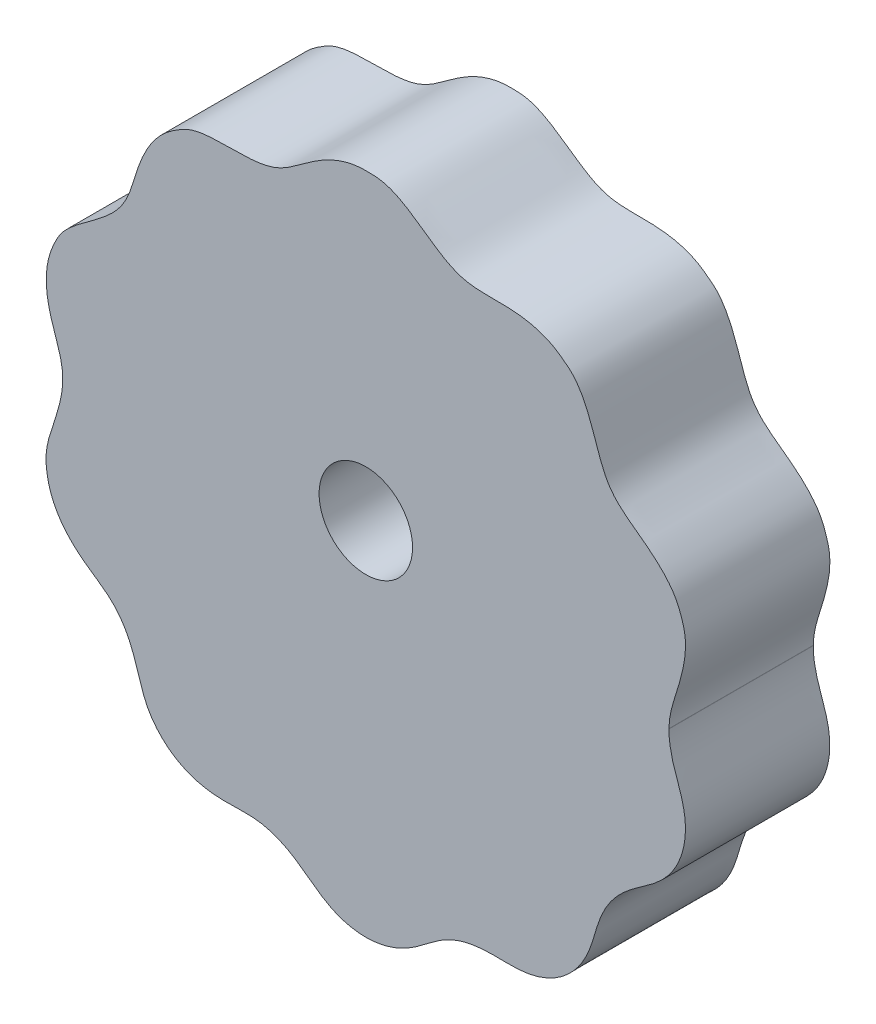
from build123d import *

# Parameters (mm, degrees)
BOSS_EXTRUDE1_DEPTH = 5
SKETCH2_R           = 1.618844033
CUT_EXTRUDE1_DEPTH  = 17.732655758


# Read off the part's stored shape, not the designer's step: Boss-Extrude1
with BuildPart() as part:
    # Boss-Extrude1 outline → Boss-Extrude1 (new body)
    with BuildSketch(Plane.XY):
        with BuildLine():
            ThreePointArc((10.5, 1e-09), (10.5000065, 0.005250059), (10.500026, 0.010500084))
            add(Edge.make_bspline(
                [(10.500026, 0.010500084), (10.500104829, 0.026418426), (10.500711566, 0.058279628), (10.503009847, 0.114829083), (10.508726656, 0.196966447), (10.518969394, 0.295241714), (10.535875913, 0.40525236), (10.561506893, 0.534666034), (10.597048035, 0.682169538), (10.637071722, 0.827718675), (10.680031003, 0.972663062), (10.727444508, 1.126258831), (10.778313871, 1.288813593), (10.84528106, 1.506056697), (10.924216926, 1.779180038), (11.003483342, 2.101494221), (11.059665237, 2.437947823), (11.08140617, 2.74012666), (11.071544465, 3.004316457), (11.042325947, 3.200172879), (10.998300633, 3.363746196), (10.954993199, 3.499695197), (10.919114129, 3.610142136), (10.87155734, 3.749924357), (10.802800407, 3.915605737), (10.702518555, 4.099545531), (10.546198292, 4.32750447), (10.343492757, 4.566838229), (10.092899585, 4.812528044), (9.79623736, 5.061693175), (9.446212806, 5.325219722), (9.051940581, 5.609976608), (8.681783648, 5.910451317), (8.401056293, 6.280926544), (8.225048404, 6.636685362), (8.102903432, 6.946209909), (7.992589426, 7.267087473), (7.881596028, 7.594881973), (7.762084294, 7.927074028), (7.623704413, 8.259245998), (7.475984099, 8.550085045), (7.316891743, 8.794957098), (7.150757, 8.992590127), (6.983282128, 9.141116165), (6.80096353, 9.273164945), (6.618334207, 9.407742368), (6.370182037, 9.551999196), (6.06478435, 9.677880619), (5.705292207, 9.774213768), (5.199387941, 9.849483561), (4.659334614, 9.871051553), (4.078900176, 9.853571976), (3.507695119, 9.891467977), (3.070153884, 10.035122873), (2.642335519, 10.261303933), (2.217770977, 10.54797182), (1.805596919, 10.848919166), (1.378476507, 11.130722122), (1.028952619, 11.314360086), (0.769392125, 11.41621199), (0.528662606, 11.474860152), (0.34014592, 11.49236954), (0.178359513, 11.497211281), (-0.042961731, 11.502564479), (-0.324456478, 11.493701175), (-0.754292044, 11.413019698), (-1.304082374, 11.195388598), (-1.845107271, 10.868412651), (-2.315421417, 10.507729401), (-2.714390062, 10.222191095), (-3.061427095, 10.044412826), (-3.35879857, 9.94321908), (-3.746590943, 9.866440771), (-4.245479962, 9.830793613), (-4.756337731, 9.832016623), (-5.2793794, 9.826468032), (-5.696251568, 9.78507082), (-5.98072233, 9.724237037), (-6.219116805, 9.636889942), (-6.409802681, 9.534541168), (-6.594810711, 9.417930808), (-6.778807071, 9.294390979), (-6.99845194, 9.11855242), (-7.268713765, 8.842910996), (-7.55097534, 8.444385754), (-7.811202515, 7.905646147), (-7.985425681, 7.367024013), (-8.122943718, 6.895741415), (-8.299566247, 6.46017283), (-8.533302235, 6.085999487), (-8.849622754, 5.755715078), (-9.21274593, 5.455724068), (-9.563414767, 5.197742787), (-9.887341504, 4.964549477), (-10.204643634, 4.717395979), (-10.460998709, 4.471501404), (-10.640957091, 4.222613381), (-10.762519876, 3.987013807), (-10.854065053, 3.785339711), (-10.957423436, 3.515363289), (-11.04660578, 3.160598673), (-11.085942971, 2.727717223), (-11.051174822, 2.253349511), (-10.958409915, 1.805906525), (-10.832335641, 1.394992908), (-10.696930873, 1.015110883), (-10.565413854, 0.615645481), (-10.487458637, 0.181998824), (-10.501724967, -0.379724647), (-10.653160108, -1.046446924), (-10.866510965, -1.627880106), (-11.034457829, -2.165859285), (-11.0808838, -2.563449442), (-11.080104434, -2.799688469), (-11.05041865, -3.0936484), (-10.984043959, -3.442262876), (-10.848306381, -3.831369253), (-10.619399827, -4.238810498), (-10.341051412, -4.591550821), (-10.031616676, -4.892069756), (-9.704007854, -5.149826617), (-9.372207785, -5.378039121), (-9.029156243, -5.61373901), (-8.701895491, -5.896143885), (-8.368190449, -6.316011033), (-8.079789361, -6.888239751), (-7.905416573, -7.445590196), (-7.755420043, -7.954566829), (-7.602721579, -8.312342441), (-7.484852743, -8.528703441), (-7.314734656, -8.775200509), (-7.084198571, -9.04231206), (-6.691714614, -9.386610423), (-6.127329701, -9.685911636), (-5.450235917, -9.854828646), (-4.734825291, -9.872890876), (-4.115935955, -9.830767113), (-3.519086675, -9.885169447), (-2.974916913, -10.064905477), (-2.445575157, -10.354101959), (-1.938854384, -10.731149932), (-1.373545903, -11.169774302), (-0.629008992, -11.482925085), (0.245211842, -11.555924515), (1.112067253, -11.324506789), (1.834026719, -10.882988175), (2.379864162, -10.40628754), (2.904575158, -10.094640473), (3.491172113, -9.895968206), (4.118765348, -9.803389546), (4.74930606, -9.829396227), (5.382294034, -9.833135114), (5.921689232, -9.727843768), (6.354136543, -9.565374086), (6.865730863, -9.261717429), (7.278901119, -8.861114065), (7.581375223, -8.399296327), (7.784675096, -7.91479491), (7.897087453, -7.56153359), (8.007114114, -7.166438716), (8.1533795, -6.739824625), (8.396100332, -6.273142549), (8.771694048, -5.805953367), (9.253144222, -5.399362084), (9.805793636, -5.044690757), (10.28894, -4.657978913), (10.650092312, -4.205424274), (10.894434479, -3.728126509), (11.035429169, -3.251420337), (11.084302419, -2.794276614), (11.060653001, -2.371926647), (10.987528582, -1.993420664), (10.900047575, -1.700821837), (10.813658983, -1.454222686), (10.743170178, -1.25479088), (10.691348242, -1.101768186), (10.645190088, -0.953513945), (10.605410718, -0.810029761), (10.571063936, -0.665080631), (10.542852229, -0.519055197), (10.521287099, -0.369796582), (10.50672438, -0.231657262), (10.501222611, -0.092870261), (10.5, -0.031362549), (10.5, 1e-09)],
                knots=[0.079309647, 0.079309647, 0.079309647, 0.079309647, 0.079309647, 0.080184008, 0.081058369, 0.081932729, 0.08280709, 0.084555811, 0.086304532, 0.088053254, 0.089801975, 0.091550696, 0.093299418, 0.095492286, 0.097685155, 0.102070892, 0.106456629, 0.110842366, 0.113452867, 0.116063367, 0.118673867, 0.119979117, 0.121284368, 0.122666171, 0.124047974, 0.126811581, 0.129575187, 0.132338794, 0.13682169, 0.141304587, 0.145787484, 0.15027038, 0.157068298, 0.163866216, 0.167713182, 0.171560148, 0.175407114, 0.17925408, 0.18341606, 0.187578041, 0.191740021, 0.195902001, 0.198484694, 0.201067388, 0.203650081, 0.206232774, 0.208898705, 0.211564635, 0.216896496, 0.22147799, 0.226059484, 0.235222471, 0.241823189, 0.248423907, 0.252369343, 0.25631478, 0.264205652, 0.272081186, 0.276018953, 0.27995672, 0.282453786, 0.284950851, 0.287447917, 0.288696449, 0.289944982, 0.295199022, 0.300453062, 0.308810021, 0.31716698, 0.324322238, 0.327899867, 0.331477496, 0.335145692, 0.338813887, 0.346150278, 0.354579479, 0.35879408, 0.363008681, 0.365507179, 0.368005676, 0.370504173, 0.373002671, 0.375629069, 0.378255467, 0.383508263, 0.390809411, 0.398110559, 0.405820467, 0.409675421, 0.413530374, 0.419811047, 0.42609172, 0.430710159, 0.435328599, 0.439947038, 0.444565478, 0.449320342, 0.451697775, 0.454075207, 0.456821902, 0.459568596, 0.465061986, 0.47094702, 0.476832055, 0.481497333, 0.48616261, 0.490827887, 0.495493165, 0.500956919, 0.506420674, 0.51668084, 0.526941006, 0.529671413, 0.53240182, 0.535132228, 0.537862635, 0.543328068, 0.548793501, 0.554093023, 0.559392545, 0.564050003, 0.568707461, 0.573364919, 0.578022377, 0.583319706, 0.588617034, 0.598042828, 0.607468621, 0.610315285, 0.613161948, 0.616008612, 0.618855276, 0.624153883, 0.629452489, 0.640052643, 0.648073718, 0.656094794, 0.66243443, 0.668774065, 0.675597492, 0.682420919, 0.690216423, 0.698011928, 0.708607383, 0.719206807, 0.730043259, 0.738735857, 0.747428455, 0.752729675, 0.758030895, 0.767294889, 0.776558882, 0.781908844, 0.787258806, 0.792559145, 0.797859483, 0.809288294, 0.813572906, 0.817857519, 0.822142131, 0.826426744, 0.832560486, 0.838694228, 0.846342809, 0.853991391, 0.861551632, 0.869111872, 0.874826494, 0.880541116, 0.886255453, 0.89196979, 0.896002036, 0.900034282, 0.904066528, 0.906082651, 0.908098774, 0.909821431, 0.911544088, 0.913266745, 0.914989402, 0.916712059, 0.918434716, 0.920157373, 0.92188003, 0.92188003, 0.92188003, 0.92188003, 0.92188003], degree=4))
        make_face()
    extrude(amount=BOSS_EXTRUDE1_DEPTH)

    # Sketch2 → Cut-Extrude1 (cut, through all)
    with BuildSketch(Plane.XY.offset(5)):
        with Locations((0, 1)):
            Circle(SKETCH2_R)
    extrude(amount=-CUT_EXTRUDE1_DEPTH, mode=Mode.SUBTRACT)


solid = part.part
